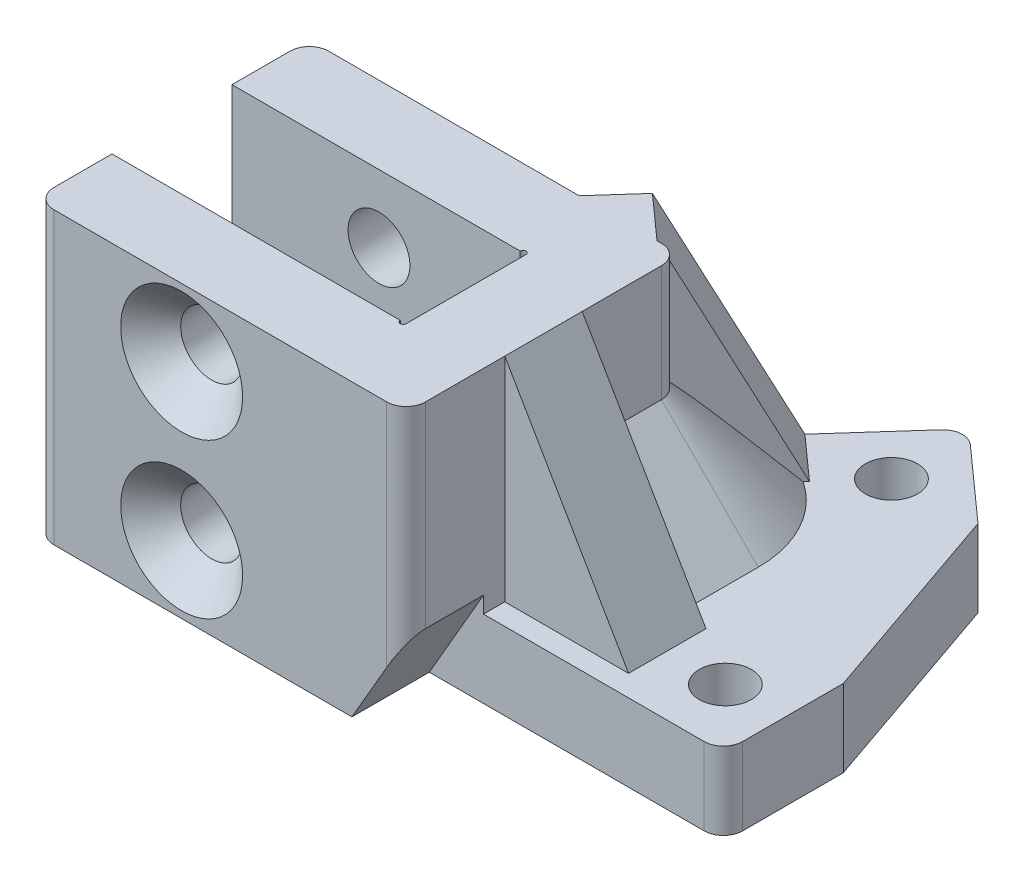
from build123d import *

# Parameters (mm, degrees)
SKETCH_1_R                   = 1.35
EXTRUDE_1_DEPTH              = 4
EXTRUDE_2_DEPTH              = 11
CUT_EXTRUDE_1_DEPTH          = 10
CUT_EXTRUDE_2_DEPTH          = 3
SKETCH_6_R                   = 1.6
CUT_EXTRUDE_3_DEPTH          = 31.233967875
SKETCH_7_R                   = 0.15
CUT_EXTRUDE_4_DEPTH          = 34.399294341
CUT_EXTRUDE_5_DEPTH          = 34.399294341
CUT_EXTRUDE_6_DEPTH          = 34.399294341
HOLE_WIZARD_M3_3_D           = 3.2
HOLE_WIZARD_M3_3_CSINK_D     = 6.3
HOLE_WIZARD_M3_3_CSINK_ANGLE = 90
EXTRUDE_3_DEPTH              = 4
FILLET_1_R                   = 1
CHAMFER_1_SIZE               = 5
CUT_EXTRUDE_7_DEPTH          = 4


with BuildPart() as part:
    # 草图1 → 凸台-拉伸1 (new body)
    with BuildSketch(Plane(origin=(0, 0, 0), x_dir=(1, 0, 0), z_dir=(0, 1, 0))):
        Polygon((7.6, -3.1), (7.6, 3.1), (-7.6, 3.1), (-7.6, -3.1), (-24, -3.1), (-24, 3.1), (-11.6, 3.1), (-11.6, 3.975781599), (-20.322903997, 13.736347087), (-15.849126022, 17.734510495), (-6.345187525, 7.1), (6.345187525, 7.1), (15.849126022, 17.734510495), (20.322903997, 13.736347087), (11.6, 3.975781599), (11.6, 3.1), (24, 3.1), (24, -3.1), align=None)
        with Locations(Location((-21, 0, 0), (0, 0, 270))):
            Circle(SKETCH_1_R, mode=Mode.SUBTRACT)
        with Locations(Location((-16.086933305, 13.498539803, 0), (0, 0, 270))):
            Circle(SKETCH_1_R, mode=Mode.SUBTRACT)
        with Locations(Location((16.086933305, 13.498539803, 0), (0, 0, 270))):
            Circle(SKETCH_1_R, mode=Mode.SUBTRACT)
        with Locations(Location((21, 0, 0), (0, 0, 270))):
            Circle(SKETCH_1_R, mode=Mode.SUBTRACT)
    extrude(amount=EXTRUDE_1_DEPTH)

    # 草图3 → 凸台-拉伸2 (add)
    with BuildSketch(Plane(origin=(0, 4, 0), x_dir=(1, 0, 0), z_dir=(0, 1, 0))):
        Polygon((-6.345187525, 7.1), (6.345187525, 7.1), (11.850962614, 13.26073252), (14.087851602, 11.261650816), (10.36863261, 7.1), (11.6, 7.1), (11.6, 2), (18, 2), (18, -2), (7.6, -2), (7.6, 3.1), (-7.6, 3.1), (-7.6, -3.1), (-18, -3.1), (-18, -0.1), (-11.6, -0.1), (-11.6, 7.1), (-10.36863261, 7.1), (-14.087851602, 11.261650816), (-11.850962614, 13.26073252), align=None)
    extrude(amount=EXTRUDE_2_DEPTH)

    # 草图4 → 切除-拉伸1 (cut)
    with BuildSketch(Plane.XY.offset(3.1)):
        Polygon((-11.6, 15), (-18, 4), (-18, 15), align=None)
        Polygon((18, 4), (18, 15), (11.6, 15), align=None)
    extrude(amount=-CUT_EXTRUDE_1_DEPTH, mode=Mode.SUBTRACT)

    # 草图5 → 切除-拉伸2 (cut)
    with BuildSketch(Plane(origin=(0, 0, 0), x_dir=(-0.6663605679521429, 0, 0.745629662418615), z_dir=(-0.745629662418615, 0, -0.6663605679521429))):
        Polygon((-12.203218518, 15), (-17.784609691, 4), (-17.784609691, 15), align=None)
    cut_extrude_2 = extrude(amount=-CUT_EXTRUDE_2_DEPTH, mode=Mode.SUBTRACT)

    # 镜向2: 切除-拉伸2 across plane
    add(cut_extrude_2.mirror(Plane(origin=(0, 0, 0), x_dir=(0, 0, 1), z_dir=(1, 0, 0))), mode=Mode.SUBTRACT)

    # 草图6 → 切除-拉伸3 (cut, through all)
    with BuildSketch(Plane(origin=(0, 0, -7.1), x_dir=(-1, 0, 0), z_dir=(0, 0, -1))):
        with Locations((0, 11.5)):
            Circle(SKETCH_6_R)
        with Locations((0, 3.5)):
            Circle(SKETCH_6_R)
    extrude(amount=-CUT_EXTRUDE_3_DEPTH, mode=Mode.SUBTRACT)

    # 草图7 → 切除-拉伸4 (cut, through all)
    with BuildSketch(Plane(origin=(0, 15, 0), x_dir=(1, 0, 0), z_dir=(0, 1, 0))):
        with Locations((7.45, 3.1)):
            Circle(SKETCH_7_R)
    extrude(amount=-CUT_EXTRUDE_4_DEPTH, mode=Mode.SUBTRACT)

    # 草图8 → 切除-拉伸5 (cut, through all)
    with BuildSketch(Plane(origin=(0, 15, 0), x_dir=(1, 0, 0), z_dir=(0, 1, 0))):
        Polygon((-7.6, 24.734510495), (-31, 24.734510495), (-31, -10.1), (-7.6, -10.1), (-7.6, 3.1), (-7.6, 7.1), (-2.6, 7.1), (-2.6, 24.734510495), align=None)
    extrude(amount=-CUT_EXTRUDE_5_DEPTH, mode=Mode.SUBTRACT)

    # 镜向3: part across plane


with BuildPart() as part_1:
    add(part.part)
    add(part.part.mirror(Plane.XY))

    # 草图9 → 切除-拉伸6 (cut, through all)
    with BuildSketch(Plane(origin=(0, 15, 0), x_dir=(1, 0, 0), z_dir=(0, 1, 0))):
        Polygon((6.345187525, -7.1), (11.6, -7.1), (11.6, -3.975781599), (21.345187525, -3.975781599), (21.345187525, -18.975781599), (6.345187525, -18.975781599), align=None)
    extrude(amount=-CUT_EXTRUDE_6_DEPTH, mode=Mode.SUBTRACT)

    # M3 锥坑高头螺钉的锥形沉头孔3 (through all)
    with Locations(Plane(origin=(0, 11.5, 7.1), x_dir=(1, 0, 0), z_dir=(0, 0, 1))):
        with Locations((0, 0), (0, -8)):
            CounterSinkHole(HOLE_WIZARD_M3_3_D / 2, HOLE_WIZARD_M3_3_CSINK_D / 2, counter_sink_angle=HOLE_WIZARD_M3_3_CSINK_ANGLE)

    # 草图12 → 凸台-拉伸3 (add)
    with BuildSketch(Plane(origin=(0, 4, 0), x_dir=(1, 0, 0), z_dir=(0, 1, 0))):
        Polygon((11.6, 3.975781599), (20.322903997, 13.736347087), (24, 3.1), (11.6, 3.1), align=None)
    extrude(amount=-EXTRUDE_3_DEPTH)

    # 圆角1
    fillet_1_edges = [part_1.edges().sort_by_distance(p)[0] for p in [
        (-7.6, 7.5, -7.1),
        (11.6, 7.5, 7.1),
        (-7.6, 7.5, 7.1),
        (15.849126022, 2, -17.734510495),
        (24, 2, 3.1),
        (11.6, 9.5, -7.1),
    ]]
    fillet(fillet_1_edges, radius=FILLET_1_R)

    # 倒角1
    # the kernel refuses this chamfer: 5 mm, written as the material it adds along each edge
    with BuildSketch(Plane(origin=(-2.48978233, 4, -7.1), x_dir=(0, -0.02749587661058641, -0.9996219169112968), z_dir=(1, 0, 0))) as chamfer_1_piece_1_section:
        Polygon((CHAMFER_1_SIZE * 0.999621916911, CHAMFER_1_SIZE * 0.0274958766106), (-CHAMFER_1_SIZE * 0.0274958766106, CHAMFER_1_SIZE * 0.999621916911), (0, 0), align=None)
    chamfer_1_piece_1 = extrude(amount=13.08978233, mode=Mode.PRIVATE)
    chamfer_1_piece_1 = split(chamfer_1_piece_1, bisect_by=Plane(origin=(10.479473381, 6.457230488, -7.224026197), z_dir=(0.7456296624186146, 0, 0.6663605679521433)), keep=Keep.TOP, mode=Mode.PRIVATE)
    add(chamfer_1_piece_1)
    with BuildSketch(Plane(origin=(10.6, 4, -6.1), x_dir=(0, 0, -1), z_dir=(-1, 0, 0))) as chamfer_1_piece_2_section:
        Polygon((1 + CHAMFER_1_SIZE, 0), (1, -CHAMFER_1_SIZE), (1, 0), align=None)
    chamfer_1_piece_2 = revolve(axis=Axis((10.6, 4, -6.1), (0, -1, 0)), revolution_arc=90, mode=Mode.PRIVATE)
    chamfer_1_piece_2 = split(chamfer_1_piece_2, bisect_by=Plane(origin=(10.960493571, 6.207373744, -7.762267712), z_dir=(0.7456296624186146, 0, 0.6663605679521433)), keep=Keep.TOP, mode=Mode.PRIVATE)
    add(chamfer_1_piece_2)
    with BuildSketch(Plane(origin=(11.6, 4, -2), x_dir=(0.9996219169112968, -0.027495876610586396, 0), z_dir=(0, 0, -1))) as chamfer_1_piece_3:
        Polygon((CHAMFER_1_SIZE * 0.999621916911, -CHAMFER_1_SIZE * 0.0274958766106), (-CHAMFER_1_SIZE * 0.0274958766106, -CHAMFER_1_SIZE * 0.999621916911), (0, 0), align=None)
    extrude(amount=4.1)

    # 草图13 → 切除-拉伸7 (cut)
    with BuildSketch(Plane.XY.offset(7.1)):
        Polygon((11.6, 4.849742261), (8.8, 0), (11.6, 0), align=None)
    extrude(amount=-CUT_EXTRUDE_7_DEPTH, mode=Mode.SUBTRACT)


solid = part_1.part
